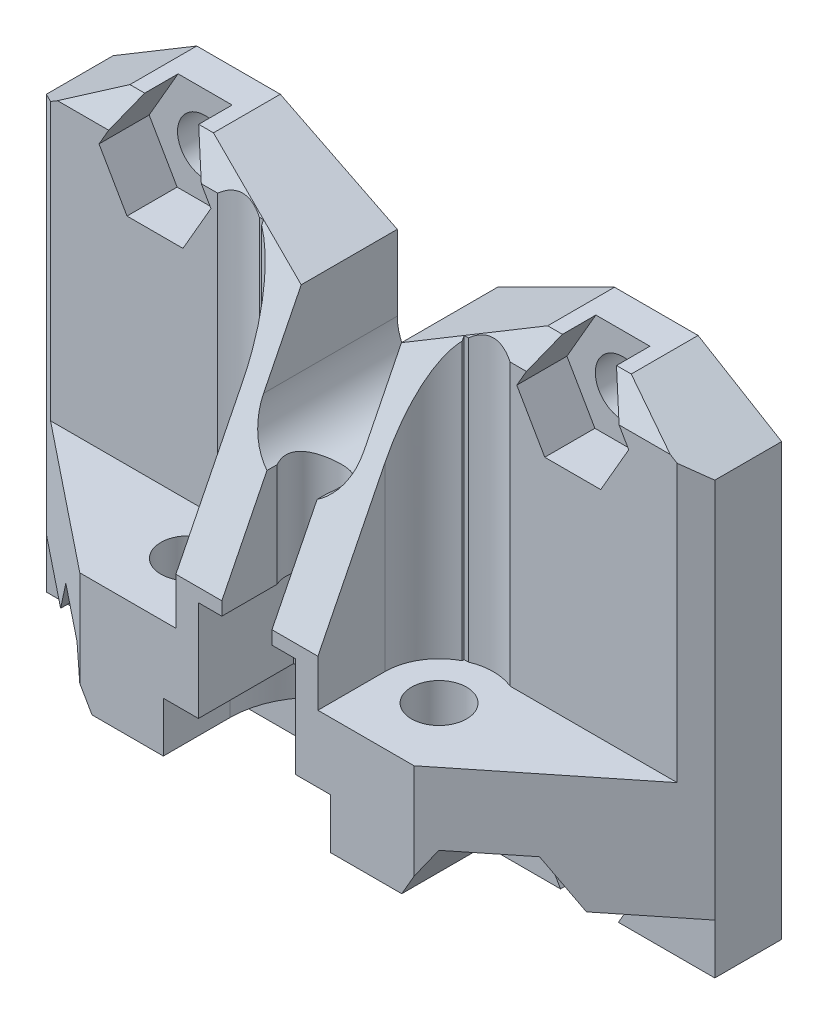
from build123d import *
from OCP.BRepFilletAPI import BRepFilletAPI_MakeChamfer

# Parameters (mm, degrees)
SKETCH1_W           = 40
SKETCH1_H           = 28.8
BOSS_EXTRUDE1_DEPTH = 12
CHAMFER2_SIZE       = 8
CHAMFER2_SIZE2      = 16
SKETCH10_W          = 14
SKETCH10_H          = 18.8
CUT_EXTRUDE7_DEPTH  = 7
SKETCH11_W          = 40
SKETCH11_H          = 3
CUT_EXTRUDE8_DEPTH  = 8
CHAMFER3_SIZE       = 8
CHAMFER3_SIZE2      = 10
CUT_EXTRUDE9_REACH  = 39.06
SKETCH13_R          = 1.65
CUT_EXTRUDE10_DEPTH = 30.957302949
CUT_EXTRUDE2_DEPTH  = 6
CUT_EXTRUDE3_DEPTH  = 38.05995143
SKETCH2_R           = 1.65
CUT_EXTRUDE1_DEPTH  = 38.05995143
CUT_EXTRUDE4_DEPTH  = 10
CUT_EXTRUDE5_DEPTH  = 6
CUT_EXTRUDE6_DEPTH  = 29.744390757
CHAMFER4_SIZE       = 3
CHAMFER4_SIZE_2     = 5
CHAMFER5_SIZE       = 3
CHAMFER5_SIZE_2     = 5
CHAMFER6_SIZE2      = 7
CHAMFER6_SIZE       = 3.5
CHAMFER7_SIZE2      = 7
CHAMFER7_SIZE       = 3.5


# Some blends are built 0.0001 mm under size
with BuildPart() as part:
    # Sketch1 → Boss-Extrude1 (new body)
    with BuildSketch(Plane.XY):
        with Locations((0, 14.4)):
            Rectangle(SKETCH1_W, SKETCH1_H)
    extrude(amount=BOSS_EXTRUDE1_DEPTH)

    # Chamfer2
    chamfer2_edges = [part.edges().sort_by_distance(p)[0] for p in [
        (0, 28.8, 12),
    ]]
    chamfer2_side = [part.faces().sort_by_distance(p)[0] for p in [
        (0, 28.8, 6),
    ]]
    chamfer(chamfer2_edges, length=CHAMFER2_SIZE, length2=CHAMFER2_SIZE2, reference=chamfer2_side[0])

    # Sketch10 → Cut-Extrude7 (cut)
    with BuildSketch(Plane.XY.offset(12)):
        with Locations((-13, 19.4)):
            Rectangle(SKETCH10_W, SKETCH10_H)
        with Locations((13, 19.4)):
            Rectangle(SKETCH10_W, SKETCH10_H)
    extrude(amount=-CUT_EXTRUDE7_DEPTH, mode=Mode.SUBTRACT)

    # Sketch11 → Cut-Extrude8 (cut)
    with BuildSketch(Plane.XY.offset(12)):
        with Locations((0, 1.5)):
            Rectangle(SKETCH11_W, SKETCH11_H)
    extrude(amount=-CUT_EXTRUDE8_DEPTH, mode=Mode.SUBTRACT)

    # Chamfer3: one chamfer whose edges measure the first distance from different faces: ONE call of the kernel's chamfer builder (chamfer() names one face for all edges)
    chamfer3_edges_1 = [part.edges().sort_by_distance(p)[0] for p in [
        (-20, 6.5, 12),
    ]]
    chamfer3_side_1 = [part.faces().sort_by_distance(p)[0] for p in [
        (-20, 12.483950617, 4.012345679),
    ]]
    chamfer3_edges_2 = [part.edges().sort_by_distance(p)[0] for p in [
        (20, 6.5, 12),
    ]]
    chamfer3_side_2 = [part.faces().sort_by_distance(p)[0] for p in [
        (20, 12.483950617, 4.012345679),
    ]]
    chamfer3 = BRepFilletAPI_MakeChamfer(part.part.solid().wrapped)
    for e in chamfer3_edges_1:
        chamfer3.Add(CHAMFER3_SIZE, CHAMFER3_SIZE2, e.wrapped, chamfer3_side_1[0].wrapped)  # the first distance lies on this face
    for e in chamfer3_edges_2:
        chamfer3.Add(CHAMFER3_SIZE, CHAMFER3_SIZE2, e.wrapped, chamfer3_side_2[0].wrapped)  # the first distance lies on this face
    add(Compound.cast(chamfer3.Shape()), mode=Mode.REPLACE)

    # Cut-Extrude9: up to this face of the body (flat: up to its plane)
    cut_extrude9_end = Plane(part.part.faces().sort_by_distance((-10.56840796, 10, 7.890547264))[0])
    # Sketch12 → Cut-Extrude9 (cut, up to the picked face)
    with BuildSketch(Plane(origin=(0, 28.8, 0), x_dir=(1, 0, 0), z_dir=(0, 1, 0)), mode=Mode.PRIVATE) as cut_extrude9_sk1:
        with BuildLine():
            Line((-4.25, -8), (-4.25, -12))
            Line((-4.25, -12), (-10.75, -12))
            Line((-10.75, -12), (-10.75, -8))
            ThreePointArc((-10.75, -8), (-7.5, -4.75), (-4.25, -8))
        make_face()
    cut_extrude9_tool1 = split(extrude(cut_extrude9_sk1.sketch, amount=-CUT_EXTRUDE9_REACH, mode=Mode.PRIVATE), bisect_by=cut_extrude9_end, keep=Keep.BOTH, mode=Mode.PRIVATE)
    cut_extrude9 = cut_extrude9_tool1.solids().sort_by(Axis((-7.5, 28.8, 8.683577), (0, -1, 0)))[0]
    add(cut_extrude9, mode=Mode.SUBTRACT)

    # Sketch13 → Cut-Extrude10 (cut, through all)
    with BuildSketch(Plane(origin=(0, 10, 0), x_dir=(1, 0, 0), z_dir=(0, 1, 0))):
        with Locations(Location((-7.5, -8, 0), (0, 0, 180))):
            Circle(SKETCH13_R)
    cut_extrude10 = extrude(amount=-CUT_EXTRUDE10_DEPTH, mode=Mode.SUBTRACT)

    # Sketch3 → Cut-Extrude2 (cut)
    with BuildSketch(Plane.XZ):
        with BuildLine():
            Line((-5, 8), (-5, 12))
            Line((-5, 12), (5, 12))
            Line((5, 12), (5, 8))
            ThreePointArc((5, 8), (0, 3), (-5, 8))
        make_face()
    extrude(amount=-CUT_EXTRUDE2_DEPTH, mode=Mode.SUBTRACT)

    # Sketch4 → Cut-Extrude3 (cut, through all)
    with BuildSketch(Plane.XY.offset(12)):
        with BuildLine():
            Line((-3, 20.8), (-3, 28.8))
            Line((-3, 28.8), (3, 28.8))
            Line((3, 28.8), (3, 20.8))
            ThreePointArc((3, 20.8), (0, 17.8), (-3, 20.8))
        make_face()
    extrude(amount=-CUT_EXTRUDE3_DEPTH, mode=Mode.SUBTRACT)

    # Sketch2 → Cut-Extrude1 (cut, through all)
    with BuildSketch(Plane.XY.offset(12)):
        with Locations((-12.5, 2.8)):
            Circle(SKETCH2_R)
        with Locations((12.5, 2.8)):
            Circle(SKETCH2_R)
        with Locations((12.5, 25.8)):
            Circle(SKETCH2_R)
        with Locations((-12.5, 25.8)):
            Circle(SKETCH2_R)
    extrude(amount=-CUT_EXTRUDE1_DEPTH, mode=Mode.SUBTRACT)

    # Sketch5 → Cut-Extrude4 (cut)
    with BuildSketch(Plane.XY.offset(12)):
        Polygon((-13.803959833, 29.341475319), (-11.196040167, 29.341475319), (-9.151368439, 25.8), (-10.825684219, 22.9), (-14.174315781, 22.9), (-15.848631561, 25.8), align=None)
        Polygon((11.196040167, 29.341475319), (13.803959833, 29.341475319), (15.848631561, 25.8), (14.174315781, 22.9), (10.825684219, 22.9), (9.151368439, 25.8), align=None)
        Polygon((-9.151368439, 2.8), (-10.825684219, 5.7), (-14.174315781, 5.7), (-15.848631561, 2.8), (-14.174315781, -0.1), (-10.825684219, -0.1), align=None)
        Polygon((15.848631561, 2.8), (14.174315781, 5.7), (10.825684219, 5.7), (9.151368439, 2.8), (10.825684219, -0.1), (14.174315781, -0.1), align=None)
    extrude(amount=-CUT_EXTRUDE4_DEPTH, mode=Mode.SUBTRACT)

    # Sketch6 → Cut-Extrude5 (cut)
    with BuildSketch(Plane.XZ.offset(-6)):
        Polygon((-2.9, 12), (2.9, 12), (2.9, 6.325684219), (0, 4.651368439), (-2.9, 6.325684219), align=None)
    extrude(amount=-CUT_EXTRUDE5_DEPTH, mode=Mode.SUBTRACT)

    # Sketch7 → Cut-Extrude6 (cut, through all)
    with BuildSketch(Plane.XZ.offset(-12)):
        with BuildLine():
            Line((-1.5, 8.687386354), (-1.5, 12))
            Line((-1.5, 12), (1.5, 12))
            Line((1.5, 12), (1.5, 8.687386354))
            ThreePointArc((1.5, 8.687386354), (0, 6.35), (-1.5, 8.687386354))
        make_face()
    extrude(amount=-CUT_EXTRUDE6_DEPTH, mode=Mode.SUBTRACT)

    # Mirror1: Cut-Extrude9, Cut-Extrude10 across plane
    add(cut_extrude9.mirror(Plane(origin=(0, 0, 0), x_dir=(0, 0, 1), z_dir=(1, 0, 0))), mode=Mode.SUBTRACT)
    add(cut_extrude10.mirror(Plane(origin=(0, 0, 0), x_dir=(0, 0, 1), z_dir=(1, 0, 0))), mode=Mode.SUBTRACT)

    # Chamfer4
    # the kernel refuses this chamfer: 5, 3 mm, written as the material it takes off along each edge
    with BuildSketch(Plane(origin=(20, 28.8, -12.931305486), x_dir=(0.05518620705976579, -0.9984760801092616, 0), z_dir=(0, 0, 1))) as chamfer4_piece_1:
        Polygon((CHAMFER4_SIZE * 0.998476080109, -CHAMFER4_SIZE * 0.0551862070598), (-CHAMFER4_SIZE_2 * 0.0551862070598, -CHAMFER4_SIZE_2 * 0.998476080109), (0, 0), align=None)
    extrude(amount=29.862610972, mode=Mode.SUBTRACT)

    # Chamfer5
    # the kernel refuses this chamfer: 5, 3 mm, written as the material it takes off along each edge
    with BuildSketch(Plane(origin=(-20, 28.8, -12.931305486), x_dir=(-0.05518620705976579, -0.9984760801092616, 0), z_dir=(0, 0, 1))) as chamfer5_piece_1:
        Polygon((CHAMFER5_SIZE * 0.998476080109, CHAMFER5_SIZE * 0.0551862070598), (-CHAMFER5_SIZE_2 * 0.0551862070598, CHAMFER5_SIZE_2 * 0.998476080109), (0, 0), align=None)
    extrude(amount=29.862610972, mode=Mode.SUBTRACT)

    # Chamfer6
    chamfer6_edges = [part.edges().sort_by_distance(p)[0] for p in [
        (-3, 28.8, 2),
    ]]
    chamfer6_side = [part.faces().sort_by_distance(p)[0] for p in [
        (-3, 28.73, 2),
    ]]
    chamfer(chamfer6_edges, length=CHAMFER6_SIZE - 0.0001, length2=CHAMFER6_SIZE2 - 0.0001, reference=chamfer6_side[0])  # a hair under: the kernel refuses the full size

    # Chamfer7
    chamfer7_edges = [part.edges().sort_by_distance(p)[0] for p in [
        (3, 28.8, 2),
    ]]
    chamfer7_side = [part.faces().sort_by_distance(p)[0] for p in [
        (3, 28.73, 2),
    ]]
    chamfer(chamfer7_edges, length=CHAMFER7_SIZE - 0.0001, length2=CHAMFER7_SIZE2 - 0.0001, reference=chamfer7_side[0])  # a hair under: the kernel refuses the full size


solid = part.part
